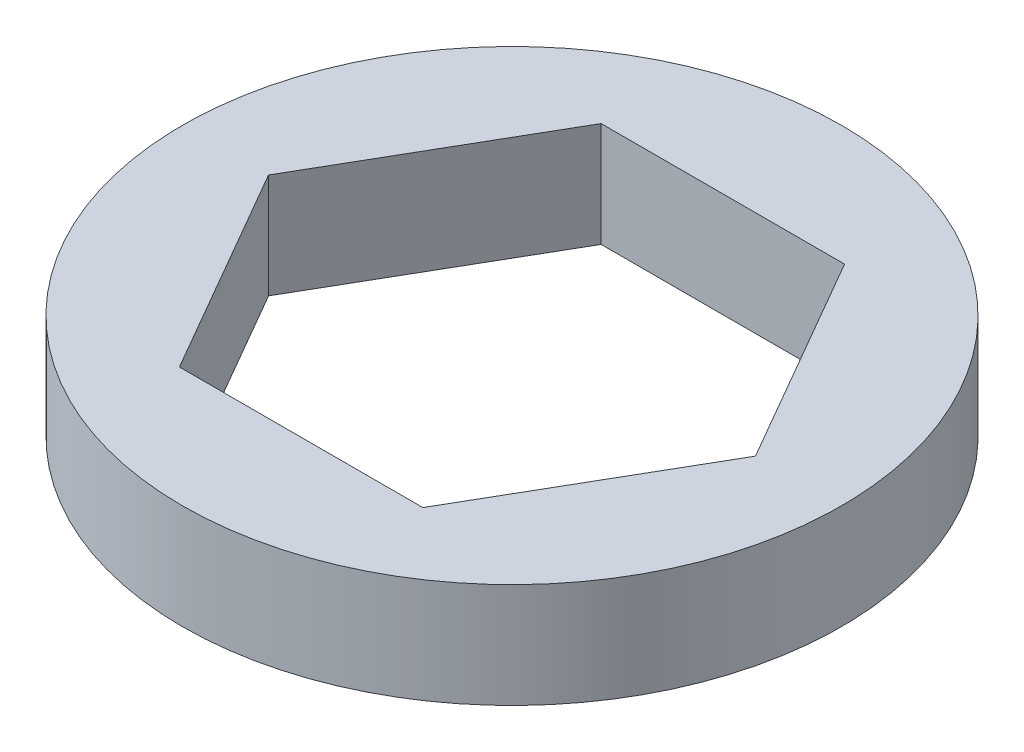
from build123d import *

# Parameters (mm, degrees)
SKETCH1_R           = 9.9949
BOSS_EXTRUDE1_DEPTH = 3.175


with BuildPart() as part:
    # Sketch1 → Boss-Extrude1 (new body)
    with BuildSketch(Plane(origin=(0, 0, 0), x_dir=(1, 0, 0), z_dir=(0, 1, 0))):
        Circle(SKETCH1_R)
        Polygon((7.383674858, 0), (3.691837429, 6.39445), (-3.691837429, 6.39445), (-7.383674858, 0), (-3.691837429, -6.39445), (3.691837429, -6.39445), align=None, mode=Mode.SUBTRACT)
    extrude(amount=BOSS_EXTRUDE1_DEPTH)


solid = part.part
